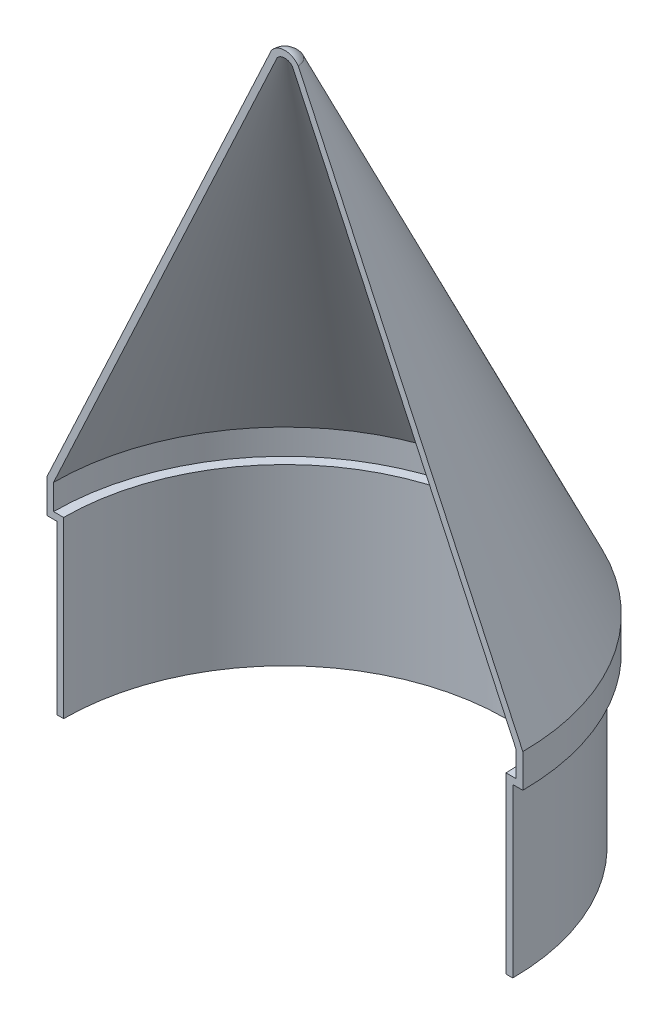
from build123d import *

# Parameters (mm, degrees)
SHELL1_T           = -2
CUT_EXTRUDE1_DEPTH = 186.253539274


with BuildPart() as part:
    # Sketch3 → Revolve1 (revolve)
    with BuildSketch(Plane.XY):
        with BuildLine():
            Line((0, 0), (0, 155.681963674))
            ThreePointArc((0, 155.681963674), (2.236067977, 155.154099629), (4, 153.681963674))
            Line((4, 153.681963674), (71, 10))
            Line((71, 10), (71, 0))
            Line((71, 0), (68, 0))
            Line((68, 0), (68, -50))
            Line((68, -50), (0, -50))
            Line((0, -50), (0, 0))
        make_face()
    revolve(axis=Axis((0, 0, 0), (0, 1, 0)))

    # Shell1
    shell1_openings = [part.faces().sort_by_distance(p)[0] for p in [
        (0, -50, 0),
    ]]
    offset(amount=SHELL1_T, openings=shell1_openings, kind=Kind.INTERSECTION)

    # Sketch4 → Cut-Extrude1 (cut, through all)
    with BuildSketch(Plane.XY):
        with BuildLine():
            Line((68, -50), (-68, -50))
            Line((-68, -50), (-68, 0))
            Line((-68, 0), (-71, 0))
            Line((-71, 0), (-71, 10))
            Line((-71, 10), (-4, 153.681963674))
            ThreePointArc((-4, 153.681963674), (0, 155.681963674), (4, 153.681963674))
            Line((4, 153.681963674), (71, 10))
            Line((71, 10), (71, 0))
            Line((71, 0), (68, 0))
            Line((68, 0), (68, -50))
        make_face()
    extrude(amount=CUT_EXTRUDE1_DEPTH, mode=Mode.SUBTRACT)


solid = part.part
